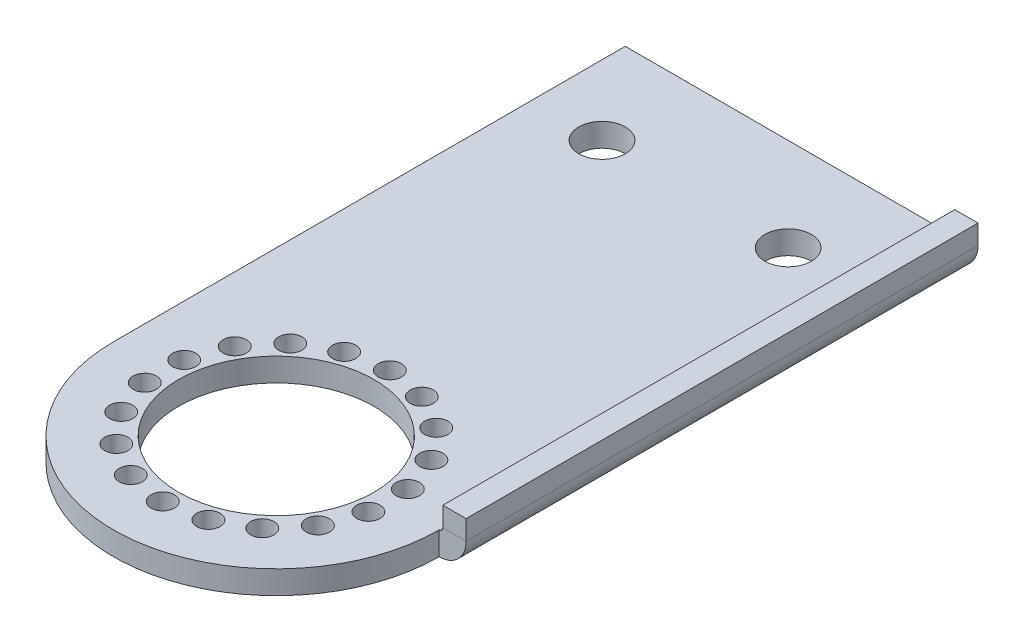
from build123d import *

# Parameters (mm, degrees)
SKETCH1_R           = 13.335
BOSS_EXTRUDE1_DEPTH = 3.175
SKETCH2_R           = 3.175
SKETCH2_R_2         = 1.5875
CUT_EXTRUDE1_DEPTH  = 74.369297053
EDGE_FLANGE2_DEPTH  = 69.85


# Sheet-metal steps are written as plain solids
with BuildPart() as part:
    # Sketch1 → Boss-Extrude1 (new body)
    with BuildSketch(Plane(origin=(0, 0, 0), x_dir=(1, 0, 0), z_dir=(0, 1, 0))):
        with BuildLine():
            Line((22.225, 0), (22.225, 69.85))
            Line((22.225, 69.85), (-22.225, 69.85))
            Line((-22.225, 69.85), (-22.225, 0))
            ThreePointArc((-22.225, 0), (0, -22.225), (22.225, 0))
        make_face()
        with Locations(Location((0, 0, 0), (0, 0, 270))):
            Circle(SKETCH1_R, mode=Mode.SUBTRACT)
    extrude(amount=BOSS_EXTRUDE1_DEPTH)

    # Sketch2 → Cut-Extrude1 (cut, through all)
    with BuildSketch(Plane(origin=(0, 3.175, 0), x_dir=(1, 0, 0), z_dir=(0, 1, 0))):
        with Locations(Location((-12.7, 57.15, 0), (0, 0, 270))):
            Circle(SKETCH2_R)
        with Locations(Location((12.7, 57.15, 0), (0, 0, 270))):
            Circle(SKETCH2_R)
        with Locations(Location((0, 15.494, 0), (0, 0, 270))):
            Circle(SKETCH2_R_2)
        with Locations(Location((5.299260101, 14.559597466, 0), (0, 0, 270))):
            Circle(SKETCH2_R_2)
        with Locations(Location((9.959351224, 11.869092602, 0), (0, 0, 270))):
            Circle(SKETCH2_R_2)
        with Locations(Location((13.418197606, 7.747, 0), (0, 0, 270))):
            Circle(SKETCH2_R_2)
        with Locations(Location((15.258611325, 2.690504865, 0), (0, 0, 270))):
            Circle(SKETCH2_R_2)
        with Locations(Location((15.258611325, -2.690504865, 0), (0, 0, 270))):
            Circle(SKETCH2_R_2)
        with Locations(Location((13.418197606, -7.747, 0), (0, 0, 270))):
            Circle(SKETCH2_R_2)
        with Locations(Location((9.959351224, -11.869092602, 0), (0, 0, 270))):
            Circle(SKETCH2_R_2)
        with Locations(Location((5.299260101, -14.559597466, 0), (0, 0, 270))):
            Circle(SKETCH2_R_2)
        with Locations(Location((0, -15.494, 0), (0, 0, 270))):
            Circle(SKETCH2_R_2)
        with Locations(Location((-5.299260101, -14.559597466, 0), (0, 0, 270))):
            Circle(SKETCH2_R_2)
        with Locations(Location((-9.959351224, -11.869092602, 0), (0, 0, 270))):
            Circle(SKETCH2_R_2)
        with Locations(Location((-13.418197606, -7.747, 0), (0, 0, 270))):
            Circle(SKETCH2_R_2)
        with Locations(Location((-15.258611325, -2.690504865, 0), (0, 0, 270))):
            Circle(SKETCH2_R_2)
        with Locations(Location((-15.258611325, 2.690504865, 0), (0, 0, 270))):
            Circle(SKETCH2_R_2)
        with Locations(Location((-13.418197606, 7.747, 0), (0, 0, 270))):
            Circle(SKETCH2_R_2)
        with Locations(Location((-9.959351224, 11.869092602, 0), (0, 0, 270))):
            Circle(SKETCH2_R_2)
        with Locations(Location((-5.299260101, 14.559597466, 0), (0, 0, 270))):
            Circle(SKETCH2_R_2)
    extrude(amount=-CUT_EXTRUDE1_DEPTH, mode=Mode.SUBTRACT)

    # Edge-Flange2 section (across the edge) → Edge-Flange2 (add)
    with BuildSketch(Plane(origin=(22.733, 3.175, 0), x_dir=(-1, 0, 0), z_dir=(0, 0, -1))):
        with BuildLine():
            Line((-3.175, 0.508), (-3.175, 3.175))
            Line((-3.175, 3.175), (0, 3.175))
            Line((0, 3.175), (0, 0.508))
            ThreePointArc((0, 0.508), (0.148789755, 0.148789755), (0.508, 0))
            Line((0.508, 0), (0.508, -3.175))
            ThreePointArc((0.508, -3.175), (-2.096274275, -2.096274275), (-3.175, 0.508))
        make_face()
    extrude(amount=EDGE_FLANGE2_DEPTH)


solid = part.part
